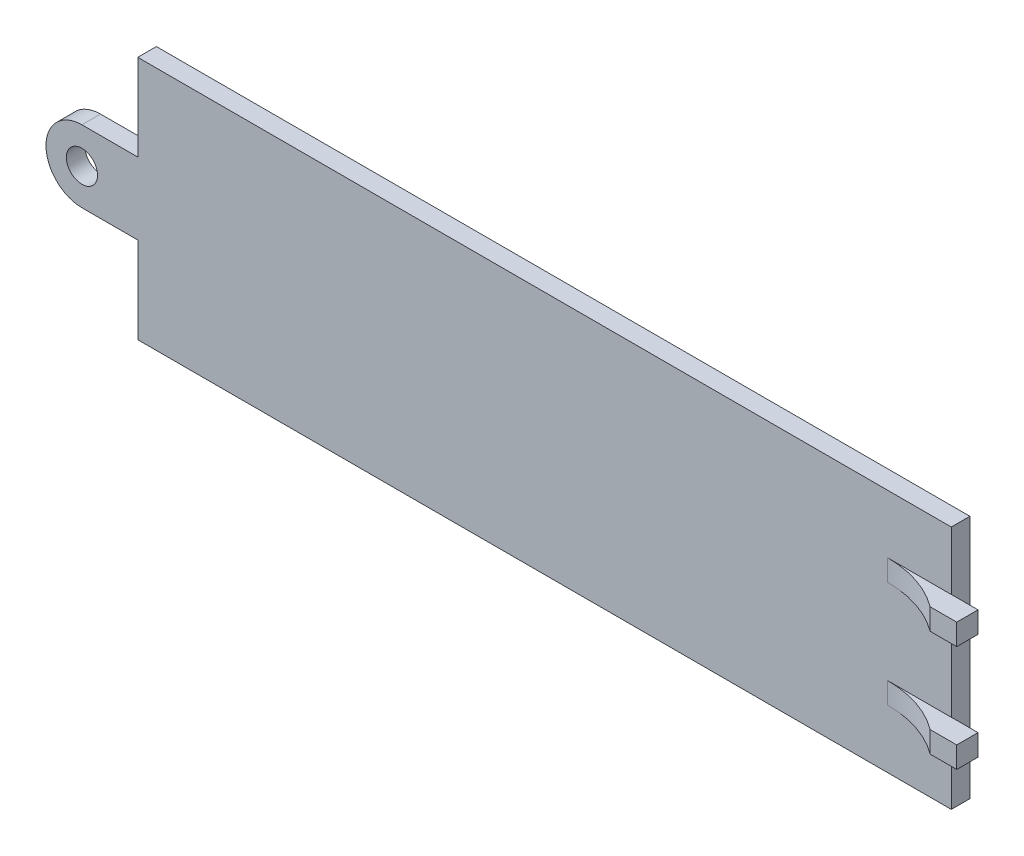
from build123d import *

# Parameters (mm, degrees)
ESBO_O1_R                = 1.465754988
RESSALTO_EXTRUS_O1_DEPTH = 1.75
ESBO_O2_W                = 2
ESBO_O2_H                = 2
RESSALTO_EXTRUS_O2_DEPTH = 2.5
FILETE1_R                = 10


with BuildPart() as part:
    # Esboço1 → Ressalto-extrusão1 (new body)
    with BuildSketch(Plane(origin=(0, 0, 0), x_dir=(0, 1, 0), z_dir=(0, 0, 1))):
        with BuildLine():
            Line((3.378557636, 38.25), (11.5, 38.25))
            Line((11.5, 38.25), (11.5, -38.25))
            Line((11.5, -38.25), (-11.5, -38.25))
            Line((-11.5, -38.25), (-11.5, 38.25))
            Line((-11.5, 38.25), (-3.378557636, 38.25))
            Line((-3.378557636, 38.25), (-3.378557636, 43.5))
            ThreePointArc((-3.378557636, 43.5), (0, 46.878557636), (3.378557636, 43.5))
            Line((3.378557636, 43.5), (3.378557636, 38.25))
        make_face()
        with Locations(Location((0, 43.5, 0), (0, 0, 270))):
            Circle(ESBO_O1_R, mode=Mode.SUBTRACT)
    extrude(amount=RESSALTO_EXTRUS_O1_DEPTH)

    # Esboço2 → Ressalto-extrusão2 (add)
    with BuildSketch(Plane(origin=(38.25, 0, 0), x_dir=(0, 0, -1), z_dir=(1, 0, 0))):
        with Locations((-2.74, -5)):
            Rectangle(ESBO_O2_W, ESBO_O2_H)
        with Locations((-2.74, 5)):
            Rectangle(ESBO_O2_W, ESBO_O2_H)
    extrude(amount=RESSALTO_EXTRUS_O2_DEPTH)

    # Filete1
    # the kernel refuses this fillet: 10 mm, written as the material it adds along each edge
    with BuildSketch(Plane(origin=(38.25, 10.966608667, 1.75), x_dir=(-1, 0, 0), z_dir=(0, -1, 0))) as filete1_piece_1_section:
        with BuildLine():
            CenterArc((5.986643467, -10), FILETE1_R, 90, 36.774298296)
            Line((0, -1.99), (0, 0))
            Line((0, 0), (5.986643467, 0))
        make_face()
    filete1_piece_1 = extrude(amount=31.933217335, mode=Mode.PRIVATE)
    filete1_piece_1 = split(filete1_piece_1, bisect_by=Plane(origin=(35.424027316, 4, 2.241553218), z_dir=(0, 1, 0)), keep=Keep.TOP, mode=Mode.PRIVATE)
    filete1_piece_1 = split(filete1_piece_1, bisect_by=Plane(origin=(35.424027316, 6, 2.241553218), z_dir=(0, -1, 0)), keep=Keep.TOP, mode=Mode.PRIVATE)
    add(filete1_piece_1)
    with BuildSketch(Plane(origin=(38.25, -4, 1.75), x_dir=(-1, 0, 0), z_dir=(0, -1, 0)), Plane(origin=(38.25, 6, 1.75), x_dir=(-1, 0, 0), z_dir=(0, -1, 0))) as filete1_piece_2:
        with BuildLine():
            CenterArc((5.986643467, -10), FILETE1_R, 90, 36.774298296)
            Line((0, -1.99), (0, 0))
            Line((0, 0), (5.986643467, 0))
        make_face()
    extrude(amount=2)
    with BuildSketch(Plane(origin=(38.25, 20.966608667, 1.75), x_dir=(-1, 0, 0), z_dir=(0, -1, 0))) as filete1_piece_3_section:
        with BuildLine():
            CenterArc((5.986643467, -10), FILETE1_R, 90, 36.774298296)
            Line((0, -1.99), (0, 0))
            Line((0, 0), (5.986643467, 0))
        make_face()
    filete1_piece_3 = extrude(amount=31.933217335, mode=Mode.PRIVATE)
    filete1_piece_3 = split(filete1_piece_3, bisect_by=Plane(origin=(35.424027316, -6, 2.241553218), z_dir=(0, 1, 0)), keep=Keep.TOP, mode=Mode.PRIVATE)
    filete1_piece_3 = split(filete1_piece_3, bisect_by=Plane(origin=(35.424027316, -4, 2.241553218), z_dir=(0, -1, 0)), keep=Keep.TOP, mode=Mode.PRIVATE)
    add(filete1_piece_3)


solid = part.part
